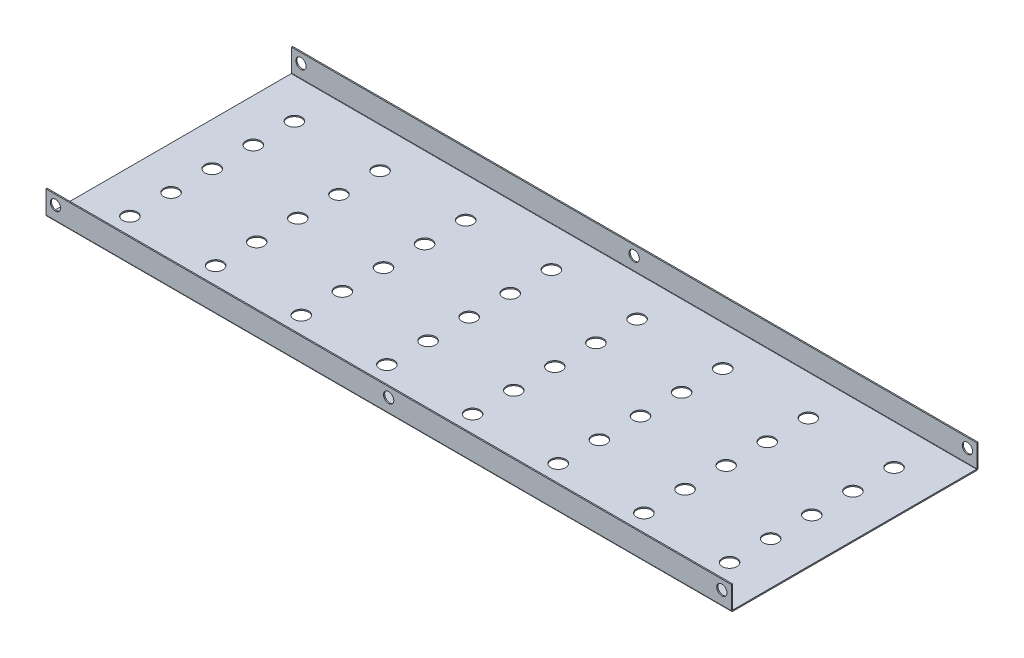
from build123d import *

# Parameters (mm, degrees)
SKETCH_1_W                         = 400
SKETCH_1_H                         = 144
SKETCH_1_R                         = 4.25
SM_BASE_FLANGE_1_DEPTH             = 0.7
SM_EDGE_FLANGE_1_STRIP_W           = 3.2
SM_EDGE_FLANGE_1_STRIP_H           = 0.7
SM_EDGE_FLANGE_1_STRIP_CUT_DEPTH   = 400
SM_EDGE_FLANGE_1_STRIP_2_W         = 3.2
SM_EDGE_FLANGE_1_STRIP_2_H         = 0.7
SM_EDGE_FLANGE_1_STRIP_CUT_2_DEPTH = 400
SM_EDGE_FLANGE_1_DEPTH             = 400
SM_EDGE_FLANGE_1_BEND_DEPTH        = 400
SKETCH_14_R                        = 3
CUT_EXTRUDE_1_DEPTH                = 10
CUT_EXTRUDE_START                  = -10
SKETCH_15_R                        = 3
CUT_EXTRUDE_2_DEPTH                = 10


# Sheet-metal steps are written as plain solids
with BuildPart() as part:
    # Sketch 1 → 基体-法兰1 (new body)
    with BuildSketch(Plane(origin=(0, 0, 0), x_dir=(1, 0, 0), z_dir=(0, 1, 0))):
        Rectangle(SKETCH_1_W, SKETCH_1_H)
        with Locations(Location((-175, -48, 0), (0, 0, 270))):
            Circle(SKETCH_1_R, mode=Mode.SUBTRACT)
        with Locations(Location((-175, -24, 0), (0, 0, 270))):
            Circle(SKETCH_1_R, mode=Mode.SUBTRACT)
        with Locations(Location((-175, 0, 0), (0, 0, 270))):
            Circle(SKETCH_1_R, mode=Mode.SUBTRACT)
        with Locations(Location((-175, 24, 0), (0, 0, 270))):
            Circle(SKETCH_1_R, mode=Mode.SUBTRACT)
        with Locations(Location((-175, 48, 0), (0, 0, 270))):
            Circle(SKETCH_1_R, mode=Mode.SUBTRACT)
        with Locations(Location((-125, -48, 0), (0, 0, 90))):
            Circle(SKETCH_1_R, mode=Mode.SUBTRACT)
        with Locations(Location((-125, -24, 0), (0, 0, 90))):
            Circle(SKETCH_1_R, mode=Mode.SUBTRACT)
        with Locations(Location((-125, 0, 0), (0, 0, 90))):
            Circle(SKETCH_1_R, mode=Mode.SUBTRACT)
        with Locations(Location((-125, 24, 0), (0, 0, 90))):
            Circle(SKETCH_1_R, mode=Mode.SUBTRACT)
        with Locations(Location((-125, 48, 0), (0, 0, 90))):
            Circle(SKETCH_1_R, mode=Mode.SUBTRACT)
        with Locations(Location((-75, -48, 0), (0, 0, 270))):
            Circle(SKETCH_1_R, mode=Mode.SUBTRACT)
        with Locations(Location((-25, -48, 0), (0, 0, 90))):
            Circle(SKETCH_1_R, mode=Mode.SUBTRACT)
        with Locations(Location((-25, -24, 0), (0, 0, 90))):
            Circle(SKETCH_1_R, mode=Mode.SUBTRACT)
        with Locations(Location((-75, -24, 0), (0, 0, 270))):
            Circle(SKETCH_1_R, mode=Mode.SUBTRACT)
        with Locations(Location((-75, 0, 0), (0, 0, 270))):
            Circle(SKETCH_1_R, mode=Mode.SUBTRACT)
        with Locations(Location((-25, 0, 0), (0, 0, 90))):
            Circle(SKETCH_1_R, mode=Mode.SUBTRACT)
        with Locations(Location((-75, 24, 0), (0, 0, 270))):
            Circle(SKETCH_1_R, mode=Mode.SUBTRACT)
        with Locations(Location((-25, 24, 0), (0, 0, 90))):
            Circle(SKETCH_1_R, mode=Mode.SUBTRACT)
        with Locations(Location((-25, 48, 0), (0, 0, 90))):
            Circle(SKETCH_1_R, mode=Mode.SUBTRACT)
        with Locations(Location((-75, 48, 0), (0, 0, 270))):
            Circle(SKETCH_1_R, mode=Mode.SUBTRACT)
        with Locations(Location((25, 48, 0), (0, 0, 270))):
            Circle(SKETCH_1_R, mode=Mode.SUBTRACT)
        with Locations(Location((25, 24, 0), (0, 0, 270))):
            Circle(SKETCH_1_R, mode=Mode.SUBTRACT)
        with Locations(Location((25, 0, 0), (0, 0, 270))):
            Circle(SKETCH_1_R, mode=Mode.SUBTRACT)
        with Locations(Location((25, -24, 0), (0, 0, 270))):
            Circle(SKETCH_1_R, mode=Mode.SUBTRACT)
        with Locations(Location((25, -48, 0), (0, 0, 270))):
            Circle(SKETCH_1_R, mode=Mode.SUBTRACT)
        with Locations(Location((75, -48, 0), (0, 0, 90))):
            Circle(SKETCH_1_R, mode=Mode.SUBTRACT)
        with Locations(Location((75, -24, 0), (0, 0, 90))):
            Circle(SKETCH_1_R, mode=Mode.SUBTRACT)
        with Locations(Location((75, 0, 0), (0, 0, 90))):
            Circle(SKETCH_1_R, mode=Mode.SUBTRACT)
        with Locations(Location((75, 24, 0), (0, 0, 90))):
            Circle(SKETCH_1_R, mode=Mode.SUBTRACT)
        with Locations(Location((75, 48, 0), (0, 0, 90))):
            Circle(SKETCH_1_R, mode=Mode.SUBTRACT)
        with Locations(Location((125, 48, 0), (0, 0, 270))):
            Circle(SKETCH_1_R, mode=Mode.SUBTRACT)
        with Locations(Location((125, 24, 0), (0, 0, 270))):
            Circle(SKETCH_1_R, mode=Mode.SUBTRACT)
        with Locations(Location((125, 0, 0), (0, 0, 270))):
            Circle(SKETCH_1_R, mode=Mode.SUBTRACT)
        with Locations(Location((125, -24, 0), (0, 0, 270))):
            Circle(SKETCH_1_R, mode=Mode.SUBTRACT)
        with Locations(Location((125, -48, 0), (0, 0, 270))):
            Circle(SKETCH_1_R, mode=Mode.SUBTRACT)
        with Locations(Location((175, -48, 0), (0, 0, 90))):
            Circle(SKETCH_1_R, mode=Mode.SUBTRACT)
        with Locations(Location((175, -24, 0), (0, 0, 90))):
            Circle(SKETCH_1_R, mode=Mode.SUBTRACT)
        with Locations(Location((175, 0, 0), (0, 0, 90))):
            Circle(SKETCH_1_R, mode=Mode.SUBTRACT)
        with Locations(Location((175, 24, 0), (0, 0, 90))):
            Circle(SKETCH_1_R, mode=Mode.SUBTRACT)
        with Locations(Location((175, 48, 0), (0, 0, 90))):
            Circle(SKETCH_1_R, mode=Mode.SUBTRACT)
    extrude(amount=-SM_BASE_FLANGE_1_DEPTH)

    # 边线-法兰1 strip (across the edge) → 边线-法兰1 strip cut (cut)
    with BuildSketch(Plane(origin=(-200, 0, 72), x_dir=(0, 0, -1), z_dir=(1, 0, 0))):
        with Locations((-0.7, -0.35)):
            Rectangle(SM_EDGE_FLANGE_1_STRIP_W, SM_EDGE_FLANGE_1_STRIP_H)
    extrude(amount=SM_EDGE_FLANGE_1_STRIP_CUT_DEPTH, mode=Mode.SUBTRACT)

    # 边线-法兰1 strip 2 (across the edge) → 边线-法兰1 strip cut 2 (cut)
    with BuildSketch(Plane(origin=(200, 0, -72), x_dir=(0, 0, 1), z_dir=(-1, 0, 0))):
        with Locations((-0.7, -0.35)):
            Rectangle(SM_EDGE_FLANGE_1_STRIP_2_W, SM_EDGE_FLANGE_1_STRIP_2_H)
    extrude(amount=SM_EDGE_FLANGE_1_STRIP_CUT_2_DEPTH, mode=Mode.SUBTRACT)

    # 边线-法兰1 section (across the edge) → 边线-法兰1 (add)
    with BuildSketch(Plane(origin=(-200, 0, 72), x_dir=(0, 0, -1), z_dir=(1, 0, 0))):
        with BuildLine():
            Line((0, 0.2), (0, 13.3))
            Line((0, 13.3), (0.7, 13.3))
            Line((0.7, 13.3), (0.7, 0.2))
            ThreePointArc((0.7, 0.2), (0.758578644, 0.058578644), (0.9, 0))
            Line((0.9, 0), (0.9, -0.7))
            ThreePointArc((0.9, -0.7), (0.263603897, -0.436396103), (0, 0.2))
        make_face()
    extrude(amount=SM_EDGE_FLANGE_1_DEPTH)

    # 边线-法兰1 section 2 (across the edge) → 边线-法兰1 bend (add)
    with BuildSketch(Plane(origin=(200, 0, -72), x_dir=(0, 0, 1), z_dir=(-1, 0, 0))):
        with BuildLine():
            Line((0, 0.2), (0, 13.3))
            Line((0, 13.3), (0.7, 13.3))
            Line((0.7, 13.3), (0.7, 0.2))
            ThreePointArc((0.7, 0.2), (0.758578644, 0.058578644), (0.9, 0))
            Line((0.9, 0), (0.9, -0.7))
            ThreePointArc((0.9, -0.7), (0.263603897, -0.436396103), (0, 0.2))
        make_face()
    extrude(amount=SM_EDGE_FLANGE_1_BEND_DEPTH)

    # 草图14 → 切除-拉伸1 (cut)
    with BuildSketch(Plane.XY.offset(72)):
        with Locations((-194.5, 7.8)):
            Circle(SKETCH_14_R)
        with Locations((0, 7.8)):
            Circle(SKETCH_14_R)
        with Locations(Location((194.5, 7.8, 0), (0, 0, 180))):
            Circle(SKETCH_14_R)
    extrude(amount=-CUT_EXTRUDE_1_DEPTH, mode=Mode.SUBTRACT)

    # 草图15 → 切除-拉伸2 (cut)
    with BuildSketch(Plane(origin=(0, 0, -72), x_dir=(-1, 0, 0), z_dir=(0, 0, -1)).offset(CUT_EXTRUDE_START)):
        with Locations((-194.5, 7.8)):
            Circle(SKETCH_15_R)
        with Locations(Location((0, 7.8, 0), (0, 0, 180))):
            Circle(SKETCH_15_R)
        with Locations(Location((194.5, 7.8, 0), (0, 0, 180))):
            Circle(SKETCH_15_R)
    extrude(amount=CUT_EXTRUDE_2_DEPTH, mode=Mode.SUBTRACT)


solid = part.part
